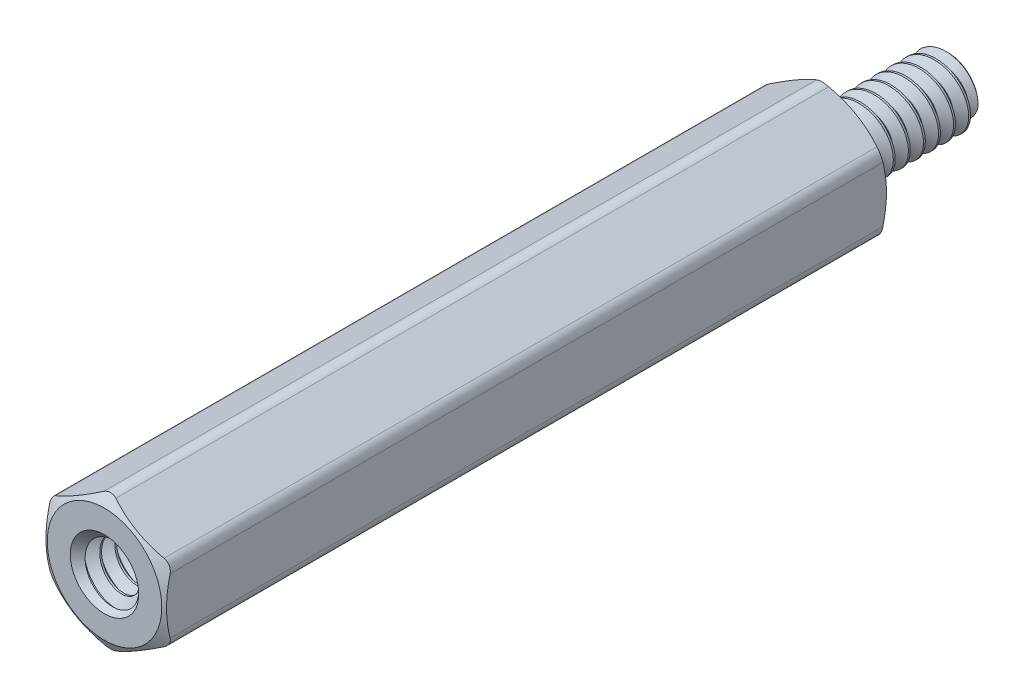
from build123d import *

# Parameters (mm, degrees)
SKETCH4_R              = 2.4638
BOSS_EXTRUDE1_DEPTH    = 38.1
SKETCH5_OUTSIDE_W      = 175.806
SKETCH5_OUTSIDE_H      = 176.788
SKETCH5_OUTSIDE_R      = 3.01625
CUT_EXTRUDE1_DEPTH     = 45.713800536
CUT_EXTRUDE1_DRAFT     = -60
SKETCH6_OUTSIDE_W      = 153.96
SKETCH6_OUTSIDE_H      = 154.942
SKETCH6_OUTSIDE_R      = 3.01625
CUT_EXTRUDE2_DEPTH     = 39.407440143
CUT_EXTRUDE2_DRAFT     = -60
FILLET1_R              = 0.635
CUT_SWEEP1_PITCH       = 0.79375
CUT_SWEEP1_HEIGHT      = 6.1595
CUT_SWEEP1_RADIUS      = 1.7526
CUT_SWEEP1_START_ANGLE = 90
SKETCH9_R              = 1.9510375
BOSS_EXTRUDE2_DEPTH    = 9.525
SKETCH10_W             = 9.525
SKETCH10_H             = 1.7526
CUT_SWEEP2_PITCH       = 0.79375
CUT_SWEEP2_HEIGHT      = 10.31875
CUT_SWEEP2_RADIUS      = 1.7526
CUT_SWEEP2_START_ANGLE = 90


with BuildPart() as part:
    # Sketch3 → Revolve1 (revolve)
    with BuildSketch(Plane(origin=(0, 0, 0), x_dir=(0, 0, -1), z_dir=(1, 0, 0))):
        with BuildLine():
            Line((-28.575, 1.5541625), (-28.575, 0))
            Line((-28.575, 0), (6.35, 0))
            Line((6.35, 0), (6.35, 1.5541625))
            Line((6.35, 1.5541625), (6.1515625, 1.7526))
            Line((6.1515625, 1.7526), (1.05965625, 1.7526))
            Line((1.05965625, 1.7526), (0.762, 1.237044252))
            Line((0.762, 1.237044252), (0.1984375, 1.237044252))
            ThreePointArc((0.1984375, 1.237044252), (0.058120998, 1.29516525), (0, 1.435481752))
            Line((0, 1.435481752), (0, 3.175))
            Line((0, 3.175), (-38.1, 3.175))
            Line((-38.1, 3.175), (-38.1, 1.9510375))
            Line((-38.1, 1.9510375), (-37.9015625, 1.7526))
            Line((-37.9015625, 1.7526), (-28.7734375, 1.7526))
            Line((-28.7734375, 1.7526), (-28.575, 1.5541625))
        make_face()
    revolve(axis=Axis((0, 0, -6.35), (0, 0, 1)))

    # Sketch4 → Boss-Extrude1 (add)
    with BuildSketch(Plane.XY.offset(38.1)):
        Polygon((-3.175, 1.833087105), (-3.175, -1.833087105), (0, -3.666174209), (3.175, -1.833087105), (3.175, 1.833087105), (0, 3.666174209), align=None)
        Circle(SKETCH4_R, mode=Mode.SUBTRACT)
    extrude(amount=-BOSS_EXTRUDE1_DEPTH)


with BuildPart() as cut_extrude1_tool:
    # Sketch5 outside → Cut-Extrude1 (with draft: the straight prism first)
    with BuildSketch(Plane.XY.offset(38.1)):
        Rectangle(SKETCH5_OUTSIDE_W, SKETCH5_OUTSIDE_H)
        Circle(SKETCH5_OUTSIDE_R, mode=Mode.SUBTRACT)
    extrude(amount=-CUT_EXTRUDE1_DEPTH)
    # Cut-Extrude1: the draft: its side faces are tilted about the plane it starts from
    cut_extrude1_sides = [cut_extrude1_tool.faces().sort_by_distance(p)[0] for p in [
        (0, -88.394, 15.243099732),
        (87.903, 0, 15.243099732),
        (0, 88.394, 15.243099732),
        (-87.903, 0, 15.243099732),
        (-3.01625, 0, 15.243099732),
    ]]
    draft(cut_extrude1_sides, Plane.XY.offset(38.1), CUT_EXTRUDE1_DRAFT)


with BuildPart() as part_1:
    add(part.part)

    # Cut-Extrude1: cut by cut_extrude1_tool
    add(cut_extrude1_tool.part, mode=Mode.SUBTRACT)


with BuildPart() as cut_extrude2_tool:
    # Sketch6 outside → Cut-Extrude2 (with draft: the straight prism first)
    with BuildSketch(Plane(origin=(0, 0, 0), x_dir=(-1, 0, 0), z_dir=(0, 0, -1))):
        Rectangle(SKETCH6_OUTSIDE_W, SKETCH6_OUTSIDE_H)
        Circle(SKETCH6_OUTSIDE_R, mode=Mode.SUBTRACT)
    extrude(amount=-CUT_EXTRUDE2_DEPTH)
    # Cut-Extrude2: the draft: its side faces are tilted about the plane it starts from
    cut_extrude2_sides = [cut_extrude2_tool.faces().sort_by_distance(p)[0] for p in [
        (0, -77.471, 19.703720071),
        (-76.98, 0, 19.703720071),
        (0, 77.471, 19.703720071),
        (76.98, 0, 19.703720071),
        (3.01625, 0, 19.703720071),
    ]]
    draft(cut_extrude2_sides, Plane(origin=(0, 0, 0), x_dir=(-1, 0, 0), z_dir=(0, 0, -1)), CUT_EXTRUDE2_DRAFT)


with BuildPart() as part_2:
    add(part_1.part)

    # Cut-Extrude2: cut by cut_extrude2_tool
    add(cut_extrude2_tool.part, mode=Mode.SUBTRACT)

    # Fillet1
    fillet1_edges = [part_2.edges().sort_by_distance(p)[0] for p in [
        (0, 3.666174209, 19.05),
        (-3.175, -1.833087105, 19.05),
        (0, -3.666174209, 19.05),
        (3.175, -1.833087105, 19.05),
        (3.175, 1.833087105, 19.05),
        (-3.175, 1.833087105, 19.05),
    ]]
    fillet(fillet1_edges, radius=FILLET1_R)

    # Cut-Sweep1: sweep along a helix
    with BuildLine() as cut_sweep1_path:
        add(Helix(CUT_SWEEP1_PITCH, CUT_SWEEP1_HEIGHT, CUT_SWEEP1_RADIUS, center=(0, 0, -6.35), direction=(0, 0, 1), mode=Mode.PRIVATE).rotate(Axis((0, 0, -6.35), (0, 0, 1)), CUT_SWEEP1_START_ANGLE))
    # Sketch7 → Cut-Sweep1 (sweep, cut)
    with BuildSketch(Plane.ZY):
        Polygon((-6.64765625, 1.237044252), (-6.746875, 1.237044252), (-7.069335938, 1.795562979), (-6.325195312, 1.795562979), align=None)
    sweep(path=cut_sweep1_path.line, is_frenet=True, mode=Mode.SUBTRACT)

    # Sketch9 → Boss-Extrude2 (add)
    with BuildSketch(Plane.XY.offset(28.575)):
        Circle(SKETCH9_R)
    extrude(amount=BOSS_EXTRUDE2_DEPTH)


with BuildPart() as body_2:
    # Sketch10 → Revolve2 (revolve)
    with BuildSketch(Plane(origin=(0, 0, 0), x_dir=(0, 0, -1), z_dir=(1, 0, 0))):
        with Locations((-33.3375, 0.8763)):
            Rectangle(SKETCH10_W, SKETCH10_H)
    revolve(axis=Axis((0, 0, -6.35), (0, 0, 1)))

    # Cut-Sweep2: sweep along a helix
    with BuildLine() as cut_sweep2_path:
        add(Helix(CUT_SWEEP2_PITCH, CUT_SWEEP2_HEIGHT, CUT_SWEEP2_RADIUS, center=(0, 0, 38.1), direction=(0, 0, -1), mode=Mode.PRIVATE).rotate(Axis((0, 0, 38.1), (0, 0, -1)), CUT_SWEEP2_START_ANGLE))
    # Sketch12 → Cut-Sweep2 (sweep, cut)
    with BuildSketch(Plane(origin=(0, 0, 0), x_dir=(0, 0, -1), z_dir=(1, 0, 0))):
        Polygon((-38.496875, 1.237044252), (-38.39765625, 1.237044252), (-38.075195313, 1.795562979), (-38.819335938, 1.795562979), align=None)
    sweep(path=cut_sweep2_path.line, is_frenet=True, mode=Mode.SUBTRACT)


with BuildPart() as part_3:
    add(part_2.part)

    # Combine1: cut body 2
    add(body_2.part, mode=Mode.SUBTRACT)

    # Cut-Extrude3 cone 1 section (through the dimple's axis) → Cut-Extrude3 (revolve, cut)
    with BuildSketch(Plane(origin=(0, 0, 38.1), x_dir=(0, -1, 0), z_dir=(1, 0, 0))):
        Polygon((0, 0), (1.8034, 0), (0, 1.8034), align=None)
    revolve(axis=Axis((0, 0, 38.1), (0, 0, -1)), mode=Mode.SUBTRACT)


solid = part_3.part
